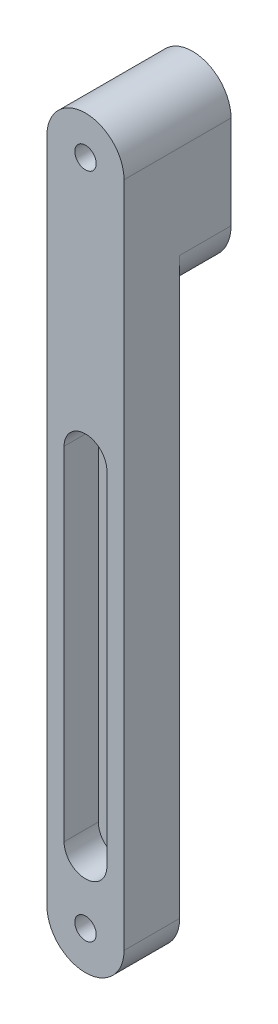
from build123d import *

# Parameters (mm, degrees)
SKETCH1_R      = 2.5
EXTRUDE1_DEPTH = 13
EXTRUDE2_DEPTH = 8
EXTRUDE3_START = 12
EXTRUDE3_DEPTH = 12
FILLET1_R      = 10
FILLET2_R      = 10
SKETCH4_R      = 2.5
EXTRUDE4_DEPTH = 112.725198761


with BuildPart() as part:
    # Sketch1 → Extrude1 (new body)
    with BuildSketch(Plane.XY):
        with BuildLine():
            Line((-9, 56.394324189), (-9, -99.519675811))
            ThreePointArc((-9, -99.519675811), (0, -108.519675811), (9, -99.519675811))
            Line((9, -99.519675811), (9, 56.394324189))
            ThreePointArc((9, 56.394324189), (0, 65.394324189), (-9, 56.394324189))
        make_face()
        with Locations(Location((0, 56.394324189, 0), (0, 0, 180))):
            Circle(SKETCH1_R, mode=Mode.SUBTRACT)
        with Locations(Location((0, -99.519675811, 0), (0, 0, 180))):
            Circle(SKETCH1_R, mode=Mode.SUBTRACT)
    extrude(amount=EXTRUDE1_DEPTH)

    # Sketch2 → Extrude2 (cut)
    with BuildSketch(Plane.XY.offset(13)):
        with BuildLine():
            Line((-5, -4.519675811), (-5, -84.519675811))
            ThreePointArc((-5, -84.519675811), (0, -89.519675811), (5, -84.519675811))
            Line((5, -84.519675811), (5, -4.519675811))
            ThreePointArc((5, -4.519675811), (0, 0.480324189), (-5, -4.519675811))
        make_face()
    extrude(amount=-EXTRUDE2_DEPTH, mode=Mode.SUBTRACT)

    # Sketch3 → Extrude3 (add)
    with BuildSketch(Plane(origin=(0, 0, 0), x_dir=(-1, 0, 0), z_dir=(0, 0, -1)).offset(EXTRUDE3_START)):
        with BuildLine():
            Line((-9, 56.394324189), (-9, 24.585637313))
            Line((-9, 24.585637313), (9, 24.585637313))
            Line((9, 24.585637313), (9, 56.394324189))
            ThreePointArc((9, 56.394324189), (0, 65.394324189), (-9, 56.394324189))
        make_face()
    extrude(amount=-EXTRUDE3_DEPTH)

    # Fillet1
    fillet1_edges = [part.edges().sort_by_distance(p)[0] for p in [
        (9, 24.585637313, -6),
    ]]
    fillet(fillet1_edges, radius=FILLET1_R)

    # Fillet2
    # the kernel refuses this fillet: 10 mm, written as the material it takes off along each edge
    with BuildSketch(Plane(origin=(-9, 24.585637313, -36.494897428), x_dir=(0, 1, 0), z_dir=(0, 0, 1))) as fillet2_piece_1:
        with BuildLine():
            CenterArc((9.797958971, -10), FILLET2_R, 90, 78.463040967)
            Line((0, -8), (-0.195959179, -7.96))
            ThreePointArc((-0.195959179, -7.96), (-0.2, -4), (-0.2, 0))
            Line((-0.2, 0), (0, 0.2))
            Line((0, 0.2), (9.797958971, 0.2))
            Line((9.797958971, 0.2), (9.797958971, 0))
        make_face()
    extrude(amount=36.494897428, mode=Mode.SUBTRACT)

    # Sketch4 → Extrude4 (cut, through all)
    with BuildSketch(Plane.XY.offset(13)):
        with Locations(Location((0, 56.394324189, 0), (0, 0, 180))):
            Circle(SKETCH4_R)
    extrude(amount=-EXTRUDE4_DEPTH, mode=Mode.SUBTRACT)


solid = part.part
